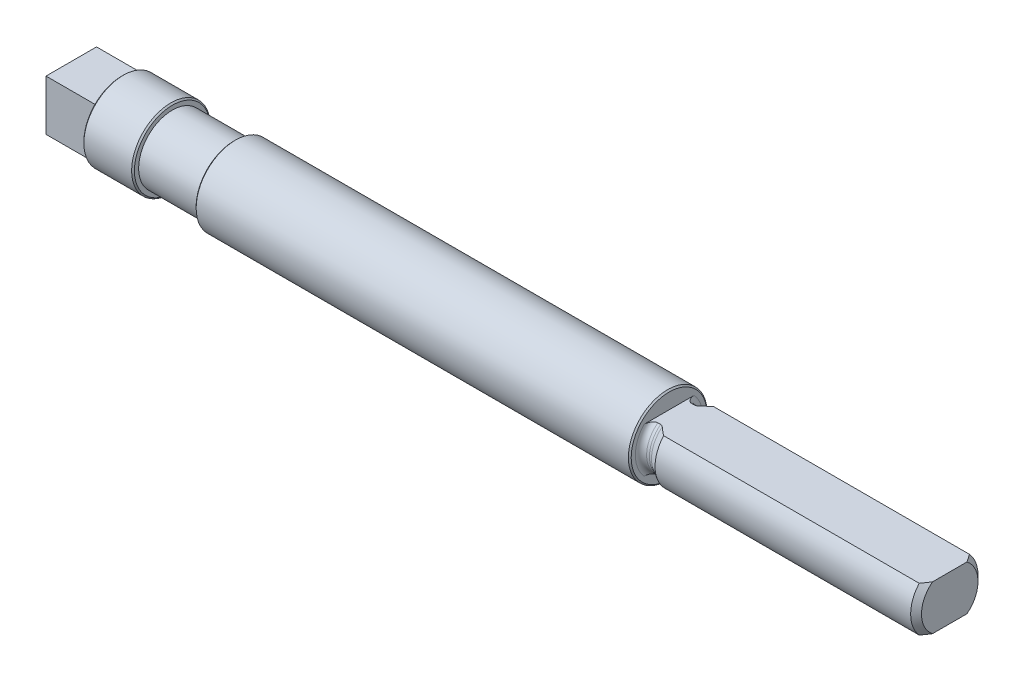
from build123d import *

# Parameters (mm, degrees)
SCHNITT_LINEAR_AUSTRAGEN1_DEPTH      = 87.078562226
SCHNITT_LINEAR_AUSTRAGEN1_DEPTH_BACK = 87.078562226
SKIZZE4_W                            = 136.51116069
SKIZZE4_H                            = 4.996766738
SCHNITT_LINEAR_START                 = -9
SKIZZE5_R                            = 7
SKIZZE5_W                            = 9
SKIZZE5_H                            = 9
SCHNITT_LINEAR_AUSTRAGEN2_DEPTH      = 9
FASE1_SIZE                           = 0.25


# Read off the part's stored shape, not the designer's step: M12 Maschinengewinde Bolzen1
with BuildPart() as part:
    # Skizze2 → Rotation1 (revolve)
    with BuildSketch(Plane.XY, mode=Mode.PRIVATE) as rotation1_sk:
        Polygon((35.507419999, 7), (35.507419999, 6), (85.507419999, 6), (85.507419999, 0), (-70.992580001, 0), (-70.992580001, 7), (-52.992580001, 7), (-52.992580001, 6), (-41.992580001, 6), (-41.992580001, 7), align=None)
    revolve(rotation1_sk.sketch.rotate(Axis((-31.289719626, 0, 0), (1, 0, 0)), 90), axis=Axis((-31.289719626, 0, 0), (1, 0, 0)))

    # M12 Maschinengewinde Bolzen1 outline → M12 Maschinengewinde Bolzen1 (revolve, cut)
    with BuildSketch(Plane.YX):
        with BuildLine():
            Line((6, 39.007419999), (5.133974596, 37.507419999))
            ThreePointArc((5.133974596, 37.507419999), (5.034074174, 37.266239044), (5, 37.007419999))
            Line((5, 37.007419999), (5, 36.507419999))
            ThreePointArc((5, 36.507419999), (5.292893219, 35.800313218), (6, 35.507419999))
            Line((6, 35.507419999), (6, 39.007419999))
        make_face()
        Polygon((5.036, 85.507419999), (6, 84.543419999), (6, 85.507419999), align=None)
    revolve(axis=Axis((0, 0, 0), (1, 0, 0)), mode=Mode.SUBTRACT)

    # Skizze4 → Schnitt-Linear austragen1 (cut, two sides: drawn at the far end of the back side and taken through both)
    with BuildSketch(Plane.XY.offset(-SCHNITT_LINEAR_AUSTRAGEN1_DEPTH_BACK)):
        with Locations((103.763000344, 6.498383369)):
            Rectangle(SKIZZE4_W, SKIZZE4_H)
        with Locations((103.763000344, -6.498383369)):
            Rectangle(SKIZZE4_W, SKIZZE4_H)
    extrude(amount=SCHNITT_LINEAR_AUSTRAGEN1_DEPTH + SCHNITT_LINEAR_AUSTRAGEN1_DEPTH_BACK, mode=Mode.SUBTRACT)

    # Skizze5 → Schnitt-Linear austragen2 (cut)
    with BuildSketch(Plane.ZY.offset(70.992580001).offset(SCHNITT_LINEAR_START)):
        Circle(SKIZZE5_R)
        Rectangle(SKIZZE5_W, SKIZZE5_H, mode=Mode.SUBTRACT)
    extrude(amount=SCHNITT_LINEAR_AUSTRAGEN2_DEPTH, mode=Mode.SUBTRACT)

    # Fase1
    fase1_edges = [part.edges().sort_by_distance(p)[0] for p in [
        (-61.992580001, 0, -7),
        (-41.992580001, 0, -7),
        (-52.992580001, 0, -7),
        (35.507419999, 0, -7),
    ]]
    chamfer(fase1_edges, length=FASE1_SIZE)


solid = part.part
